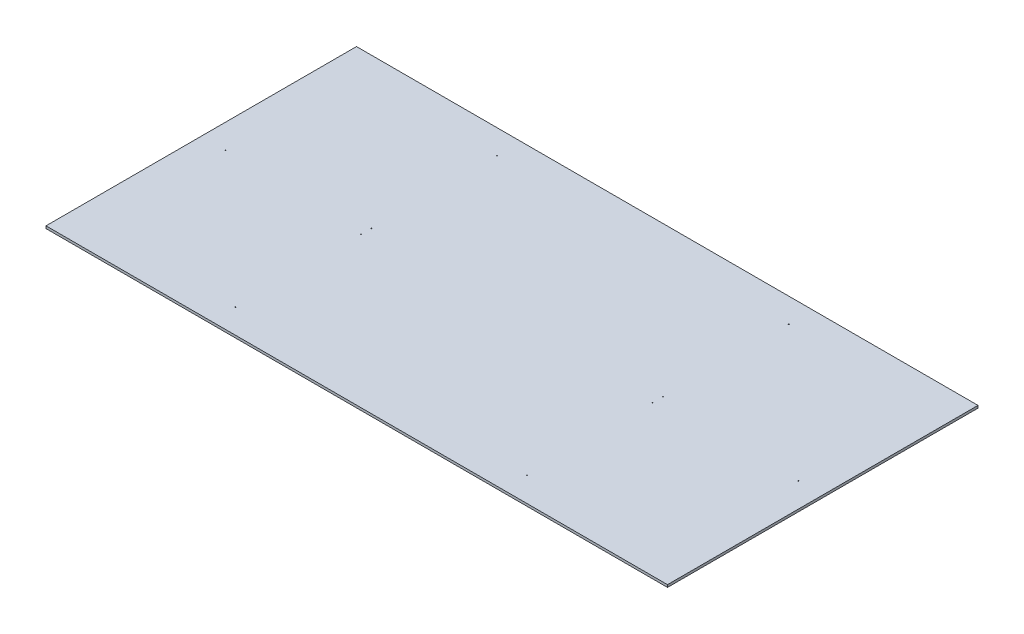
from build123d import *

# Parameters (mm, degrees)
SKETCH1_W                    = 255.8
SKETCH1_H                    = 127.8
BOSS_EXTRUDE1_DEPTH          = 1
F_0_35_0_35_DIAMETER_HOLE1_D = 0.35


with BuildPart() as part:
    # Sketch1 → Boss-Extrude1 (new body)
    with BuildSketch(Plane(origin=(0, 0, 0), x_dir=(1, 0, 0), z_dir=(0, 1, 0))):
        Rectangle(SKETCH1_W, SKETCH1_H)
    extrude(amount=BOSS_EXTRUDE1_DEPTH)

    # Ø0.35 (0.35) Diameter Hole1 (through all)
    with Locations(Plane(origin=(0, 1, 0), x_dir=(1, 0, 0), z_dir=(0, 1, 0))):
        with Locations((-117.875, 0), (-60, 2.125), (-60, 53.875), (-60, -2.125), (-60, -53.875), (117.875, 0), (60, -53.875), (60, -2.125), (60, 2.125), (60, 53.875)):
            Hole(F_0_35_0_35_DIAMETER_HOLE1_D / 2)


solid = part.part
